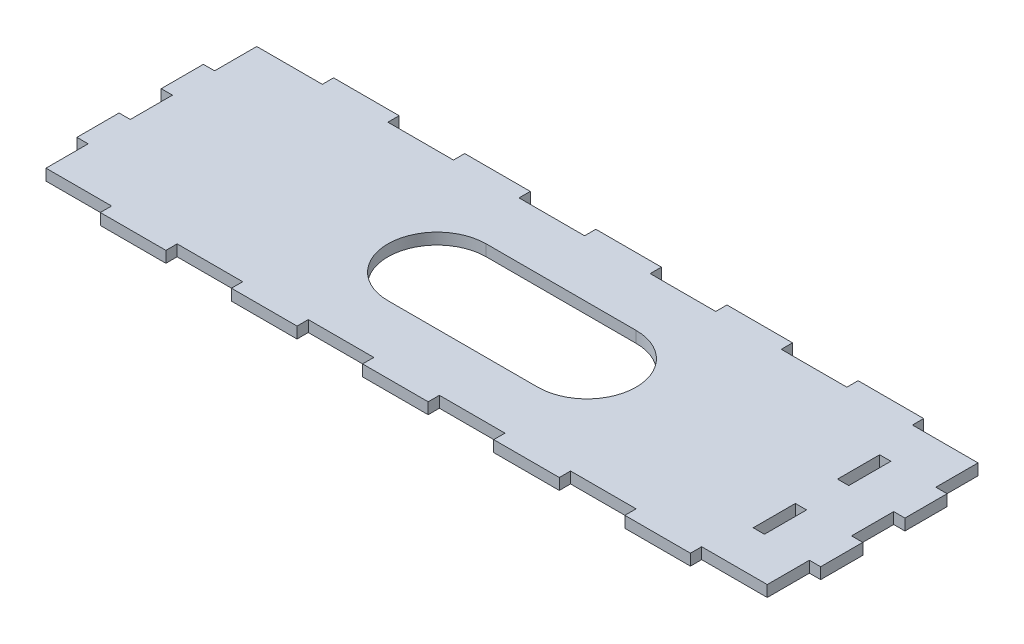
from build123d import *

# Parameters (mm, degrees)
SKETCH1_W           = 385
SKETCH1_H           = 112.5
BOSS_EXTRUDE1_DEPTH = 6
SKETCH2_W           = 22.5
SKETCH2_H           = 6
BOSS_EXTRUDE2_DEPTH = 6
SKETCH3_W           = 35
SKETCH3_H           = 6
BOSS_EXTRUDE3_DEPTH = 6
SKETCH4_W           = 6
SKETCH4_H           = 22.5
CUT_EXTRUDE1_DEPTH  = 6
CUT_EXTRUDE2_DEPTH  = 209.118505905


with BuildPart() as part:
    # Sketch1 → Boss-Extrude1 (new body)
    with BuildSketch(Plane(origin=(0, 0, 0), x_dir=(1, 0, 0), z_dir=(0, 1, 0))):
        Rectangle(SKETCH1_W, SKETCH1_H)
    extrude(amount=BOSS_EXTRUDE1_DEPTH)

    # Sketch2 → Boss-Extrude2 (add)
    with BuildSketch(Plane.ZY.offset(192.5)):
        with Locations((-22.5, 3)):
            Rectangle(SKETCH2_W, SKETCH2_H)
        with Locations((22.5, 3)):
            Rectangle(SKETCH2_W, SKETCH2_H)
    boss_extrude2 = extrude(amount=BOSS_EXTRUDE2_DEPTH)

    # Mirror1: Boss-Extrude2 across plane
    add(boss_extrude2.mirror(Plane(origin=(0, 0, 0), x_dir=(0, 0, 1), z_dir=(1, 0, 0))))

    # Sketch3 → Boss-Extrude3 (add)
    with BuildSketch(Plane(origin=(0, 0, -56.25), x_dir=(-1, 0, 0), z_dir=(0, 0, -1))):
        with Locations((140, 3)):
            Rectangle(SKETCH3_W, SKETCH3_H)
        with Locations((70, 3)):
            Rectangle(SKETCH3_W, SKETCH3_H)
        with Locations((0, 3)):
            Rectangle(SKETCH3_W, SKETCH3_H)
        with Locations((-70, 3)):
            Rectangle(SKETCH3_W, SKETCH3_H)
        with Locations((-140, 3)):
            Rectangle(SKETCH3_W, SKETCH3_H)
    boss_extrude3 = extrude(amount=BOSS_EXTRUDE3_DEPTH)

    # Mirror2: Boss-Extrude3 across plane
    add(boss_extrude3.mirror(Plane.XY))

    # Sketch4 → Cut-Extrude1 (cut)
    with BuildSketch(Plane.XZ):
        with Locations((165.5, 22.5)):
            Rectangle(SKETCH4_W, SKETCH4_H)
        with Locations((165.5, -22.5)):
            Rectangle(SKETCH4_W, SKETCH4_H)
    extrude(amount=-CUT_EXTRUDE1_DEPTH, mode=Mode.SUBTRACT)

    # Sketch5 → Cut-Extrude2 (cut, through all)
    with BuildSketch(Plane(origin=(0, 6, 0), x_dir=(1, 0, 0), z_dir=(0, 1, 0))):
        with BuildLine():
            Line((40, -26.25), (-40, -26.25))
            ThreePointArc((-40, -26.25), (-66.25, 0), (-40, 26.25))
            Line((-40, 26.25), (40, 26.25))
            ThreePointArc((40, 26.25), (66.25, 0), (40, -26.25))
        make_face()
    extrude(amount=-CUT_EXTRUDE2_DEPTH, mode=Mode.SUBTRACT)


solid = part.part
